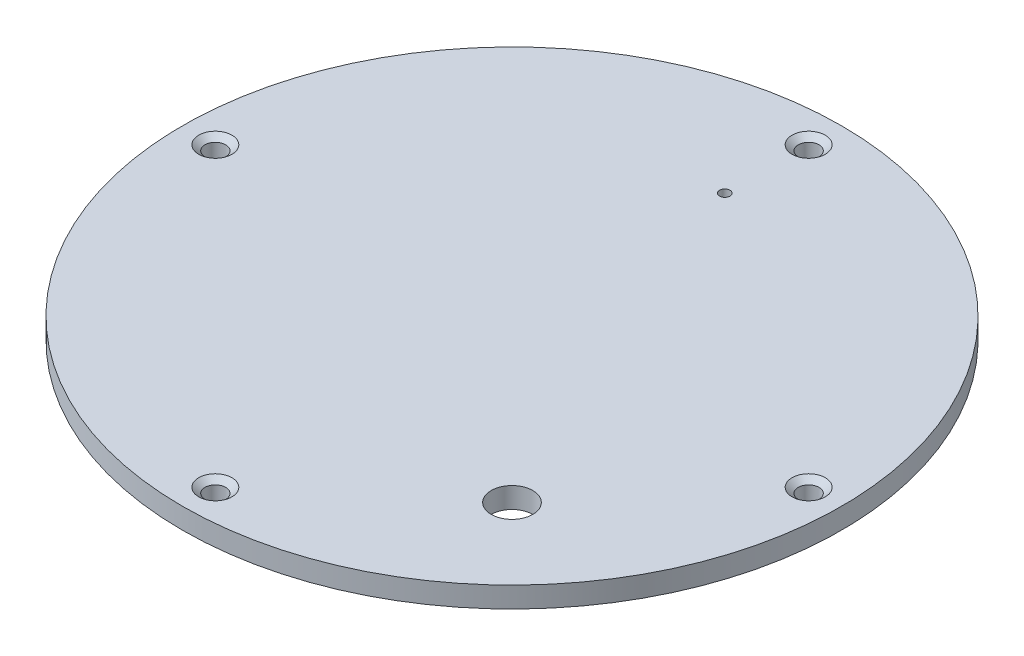
from build123d import *

# Parameters (mm, degrees)
SKETCH1_R                                       = 15.875
BOSS_EXTRUDE1_DEPTH                             = 1
CUT_EXTRUDE1_DEPTH                              = 23.472900347
CUT_EXTRUDE1_DEPTH_BACK                         = 23.472900347
SKETCH6_R                                       = 0.25
SKETCH6_R_2                                     = 1
CSK_FOR_M2_FLAT_HEAD_MACHINE_SCREW1_D           = 1
CSK_FOR_M2_FLAT_HEAD_MACHINE_SCREW1_CSINK_D     = 1.6
CSK_FOR_M2_FLAT_HEAD_MACHINE_SCREW1_CSINK_ANGLE = 100


with BuildPart() as part:
    # Sketch1 → Boss-Extrude1 (new body)
    with BuildSketch(Plane(origin=(0, 0, 0), x_dir=(1, 0, 0), z_dir=(0, 1, 0))):
        Circle(SKETCH1_R)
    extrude(amount=BOSS_EXTRUDE1_DEPTH)

    # Sketch6 → Cut-Extrude1 (cut, two sides: drawn at the far end of the back side and taken through both)
    with BuildSketch(Plane(origin=(0, 1, 0), x_dir=(1, 0, 0), z_dir=(0, 1, 0)).offset(-CUT_EXTRUDE1_DEPTH_BACK)):
        with Locations((0, 10.25)):
            Circle(SKETCH6_R)
        with Locations((7.778174593, -7.778174593)):
            Circle(SKETCH6_R_2)
    extrude(amount=CUT_EXTRUDE1_DEPTH + CUT_EXTRUDE1_DEPTH_BACK, mode=Mode.SUBTRACT)

    # CSK for M2 Flat Head Machine Screw1 (through all)
    with Locations(Plane(origin=(0, 1, 0), x_dir=(1, 0, 0), z_dir=(0, 1, 0))):
        with Locations((0, 14.29), (-14.29, 0), (0, -14.29), (14.29, 0)):
            CounterSinkHole(CSK_FOR_M2_FLAT_HEAD_MACHINE_SCREW1_D / 2, CSK_FOR_M2_FLAT_HEAD_MACHINE_SCREW1_CSINK_D / 2, counter_sink_angle=CSK_FOR_M2_FLAT_HEAD_MACHINE_SCREW1_CSINK_ANGLE)


solid = part.part
